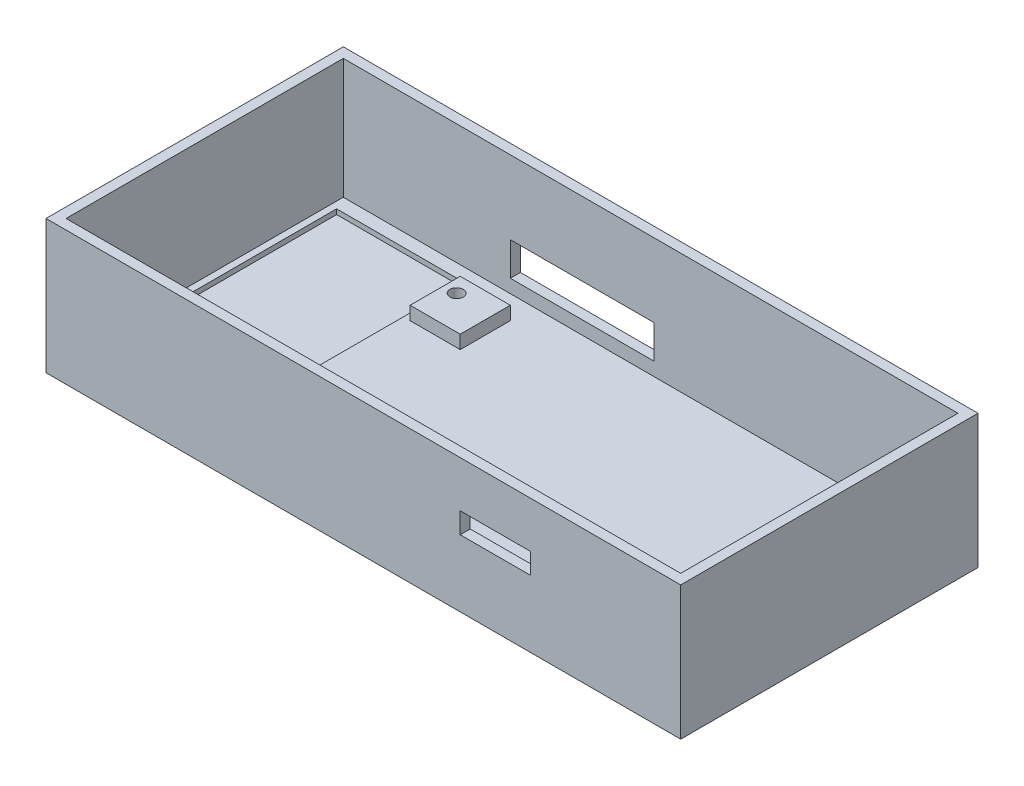
from build123d import *

# Parameters (mm, degrees)
SKETCH1_W           = 141
SKETCH1_H           = 76
BOSS_EXTRUDE2_DEPTH = 4
SKETCH4_W           = 15
SKETCH4_H           = 15
BOSS_EXTRUDE3_DEPTH = 4
SKETCH5_W           = 76
SKETCH5_H           = 4
BOSS_EXTRUDE4_DEPTH = 42
SKETCH6_W           = 183
SKETCH6_H           = 4
BOSS_EXTRUDE5_DEPTH = 7
SKETCH8_W           = 83
SKETCH8_H           = 4
BOSS_EXTRUDE7_DEPTH = 1
SKETCH7_W           = 190
SKETCH7_H           = 89
SKETCH7_W_2         = 184
SKETCH7_H_2         = 83
BOSS_EXTRUDE6_DEPTH = 40
SKETCH9_R           = 2
CUT_EXTRUDE3_DEPTH  = 4.1
CUT_EXTRUDE4_REACH  = 153.199
SKETCH10_W          = 43
SKETCH10_H          = 10
SKETCH11_W          = 38
SKETCH11_H          = 77
CUT_EXTRUDE5_DEPTH  = 1.5
CUT_EXTRUDE6_REACH  = 153.199
SKETCH13_W          = 21
SKETCH13_H          = 6.2


with BuildPart() as part:
    # Sketch1 → Boss-Extrude2 (new body)
    with BuildSketch(Plane(origin=(0, 0, 0), x_dir=(1, 0, 0), z_dir=(0, 1, 0))):
        Rectangle(SKETCH1_W, SKETCH1_H)
    extrude(amount=BOSS_EXTRUDE2_DEPTH)

    # Sketch4 → Boss-Extrude3 (add)
    with BuildSketch(Plane(origin=(0, 4, 0), x_dir=(1, 0, 0), z_dir=(0, 1, 0))):
        with Locations((-63, 30.5)):
            Rectangle(SKETCH4_W, SKETCH4_H)
        with Locations((-63, -30.5)):
            Rectangle(SKETCH4_W, SKETCH4_H)
        with Locations((63, 30.5)):
            Rectangle(SKETCH4_W, SKETCH4_H)
        with Locations((63, -30.5)):
            Rectangle(SKETCH4_W, SKETCH4_H)
    extrude(amount=BOSS_EXTRUDE3_DEPTH)

    # Sketch5 → Boss-Extrude4 (add)
    with BuildSketch(Plane.ZY.offset(70.5)):
        with Locations((0, 2)):
            Rectangle(SKETCH5_W, SKETCH5_H)
    extrude(amount=BOSS_EXTRUDE4_DEPTH)

    # Sketch6 → Boss-Extrude5 (add)
    with BuildSketch(Plane(origin=(0, 0, -38), x_dir=(-1, 0, 0), z_dir=(0, 0, -1))):
        with Locations((21, 2)):
            Rectangle(SKETCH6_W, SKETCH6_H)
    extrude(amount=BOSS_EXTRUDE5_DEPTH)

    # Sketch8 → Boss-Extrude7 (add)
    with BuildSketch(Plane(origin=(70.5, 0, 0), x_dir=(0, 0, -1), z_dir=(1, 0, 0))):
        with Locations((3.5, 2)):
            Rectangle(SKETCH8_W, SKETCH8_H)
    extrude(amount=BOSS_EXTRUDE7_DEPTH)

    # Sketch7 → Boss-Extrude6 (add)
    with BuildSketch(Plane.XZ):
        with Locations((-20.5, -3.5)):
            Rectangle(SKETCH7_W, SKETCH7_H)
        with Locations((-20.5, -3.5)):
            Rectangle(SKETCH7_W_2, SKETCH7_H_2, mode=Mode.SUBTRACT)
    extrude(amount=-BOSS_EXTRUDE6_DEPTH)

    # Sketch9 → Cut-Extrude3 (cut)
    with BuildSketch(Plane(origin=(0, 8, 0), x_dir=(1, 0, 0), z_dir=(0, 1, 0))):
        with Locations((-66.665, 33.08)):
            Circle(SKETCH9_R)
        with Locations((-66.665, -31.92)):
            Circle(SKETCH9_R)
        with Locations((64.335, -31.92)):
            Circle(SKETCH9_R)
        with Locations((64.335, 32.935)):
            Circle(SKETCH9_R)
    extrude(amount=-CUT_EXTRUDE3_DEPTH, mode=Mode.SUBTRACT)

    # Sketch10 → Cut-Extrude4 (cut, up to next)
    with BuildSketch(Plane(origin=(0, 0, -48), x_dir=(-1, 0, 0), z_dir=(0, 0, -1)), mode=Mode.PRIVATE) as cut_extrude4_sk1:
        with Locations((41, 13)):
            Rectangle(SKETCH10_W, SKETCH10_H)
    cut_extrude4_tool1 = extrude(cut_extrude4_sk1.sketch, amount=-CUT_EXTRUDE4_REACH, mode=Mode.PRIVATE) & part.part
    add(cut_extrude4_tool1.solids().sort_by_distance((-41, 13, -48))[0], mode=Mode.SUBTRACT)

    # Sketch11 → Cut-Extrude5 (cut)
    with BuildSketch(Plane(origin=(0, 4, 0), x_dir=(1, 0, 0), z_dir=(0, 1, 0))):
        with Locations((-91.5, 2.5)):
            Rectangle(SKETCH11_W, SKETCH11_H)
    extrude(amount=-CUT_EXTRUDE5_DEPTH, mode=Mode.SUBTRACT)

    # Sketch13 → Cut-Extrude6 (cut, up to next)
    with BuildSketch(Plane.XY.offset(41), mode=Mode.PRIVATE) as cut_extrude6_sk1:
        with Locations((19, 23.1)):
            Rectangle(SKETCH13_W, SKETCH13_H)
    cut_extrude6_tool1 = extrude(cut_extrude6_sk1.sketch, amount=-CUT_EXTRUDE6_REACH, mode=Mode.PRIVATE) & part.part
    add(cut_extrude6_tool1.solids().sort_by_distance((19, 23.1, 41))[0], mode=Mode.SUBTRACT)


solid = part.part
